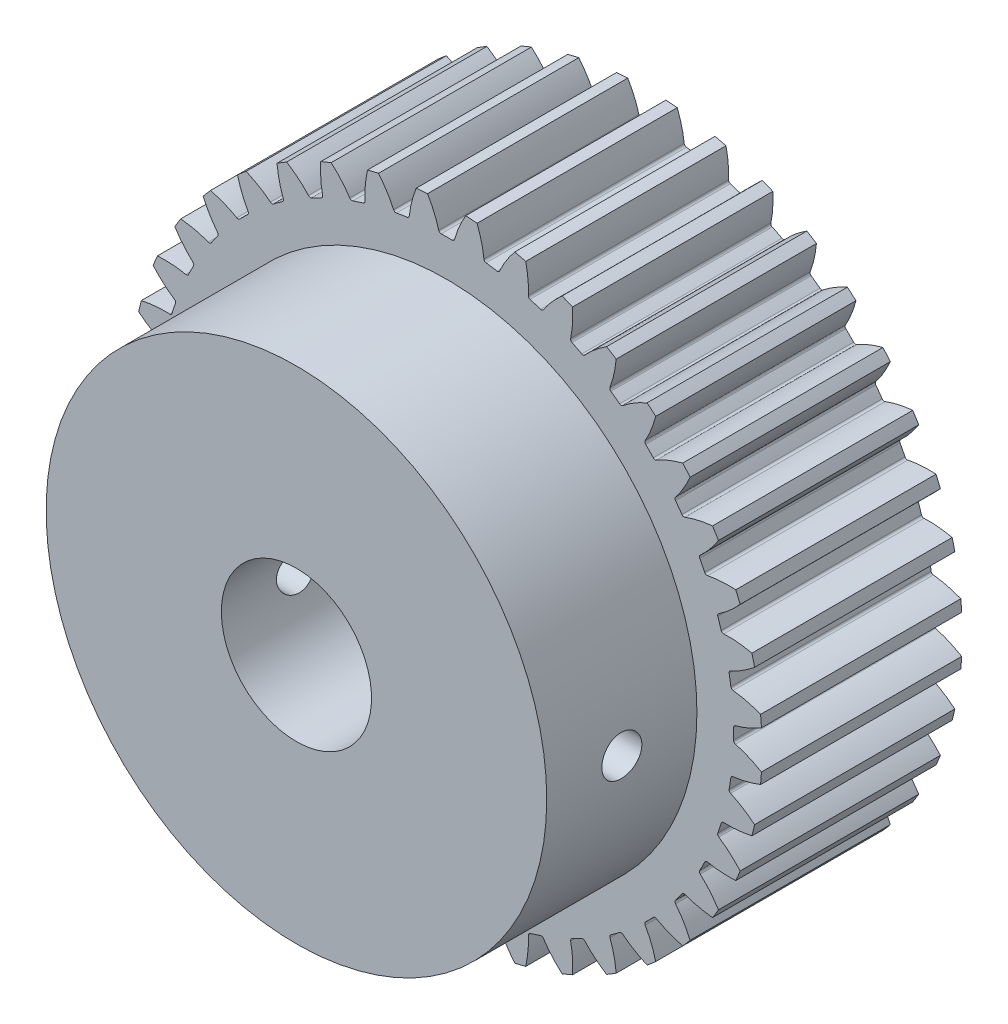
from build123d import *

# Parameters (mm, degrees)
SKETCH1_R                = 31.5
BOSS_EXTRUDE1_DEPTH      = 20
CUT_EXTRUDE2_DEPTH       = 49.831342394
FILLET1_R                = 0.25
CIRPATTERN1_COUNT        = 40
FILLET1_OF_CIRPATTERN1_R = 0.25
SKETCH1_8_R              = 25
BOSS_EXTRUDE2_DEPTH      = 35
SKETCH2_R                = 7.5
CUT_EXTRUDE4_DEPTH       = 57.588251431
SKETCH3_R                = 2
CUT_EXTRUDE6_DEPTH       = 74.480219868


with BuildPart() as part:
    # Sketch1 → Boss-Extrude1 (new body)
    with BuildSketch(Plane.XY):
        Circle(SKETCH1_R)
    extrude(amount=BOSS_EXTRUDE1_DEPTH)

    # Sketch1<5> → Cut-Extrude2 (cut, through all)
    with BuildSketch(Plane.XY):
        with BuildLine():
            add(Edge.make_bspline(
                [(-1.906543024, 31.442250137), (-1.695696445, 31.078842528), (-1.308431171, 30.336664954), (-0.941741922, 29.392730706), (-0.785074835, 28.820981083), (-0.748482141, 28.649753144)],
                knots=[0.31361624, 0.31361624, 0.31361624, 0.31361624, 0.385710722, 0.457140092, 0.487211711, 0.487211711, 0.487211711, 0.487211711], degree=3))
            ThreePointArc((-0.748482141, 28.649753144), (0, 28.65952862), (0.748482141, 28.649753144))
            add(Edge.make_bspline(
                [(1.906543024, 31.442250137), (1.695696445, 31.078842528), (1.308431171, 30.336664954), (0.941741922, 29.392730706), (0.785074835, 28.820981083), (0.748482141, 28.649753144)],
                knots=[0.31361624, 0.31361624, 0.31361624, 0.31361624, 0.385710722, 0.457140092, 0.487211711, 0.487211711, 0.487211711, 0.487211711], degree=3))
            ThreePointArc((1.906543024, 31.442250137), (0, 31.5), (-1.906543024, 31.442250137))
        make_face()
    cut_extrude2 = extrude(amount=CUT_EXTRUDE2_DEPTH, mode=Mode.SUBTRACT)

    # Fillet1
    fillet1_edges = [part.edges().sort_by_distance(p)[0] for p in [
        (0.748482141, 28.649753144, 10),
        (-0.748482141, 28.649753144, 10),
    ]]
    fillet(fillet1_edges, radius=FILLET1_R)

    # CirPattern1: Cut-Extrude2 ×40 about axis
    cirpattern1_axis = Axis((0, 0, 20), (0, 0, -1))
    for i in range(1, CIRPATTERN1_COUNT):
        add(cut_extrude2.rotate(cirpattern1_axis, i * 360 / CIRPATTERN1_COUNT), mode=Mode.SUBTRACT)

    # Fillet1 of CirPattern1
    fillet1_of_cirpattern1_edges = [part.edges().sort_by_distance(p)[0] for p in [
        (5.22107589, 28.179938738, 10),
        (3.742541723, 28.414115544, 10),
        (9.565109423, 27.016240716, 10),
        (8.141411789, 27.478828119, 10),
        (13.673618218, 25.187313187, 10),
        (12.339813277, 25.866920749, 10),
        (17.445437151, 22.738190414, 10),
        (16.234367608, 23.618083942, 10),
        (20.787691525, 19.72917793, 10),
        (19.72917793, 20.787691525, 10),
        (23.618083942, 16.234367608, 10),
        (22.738190414, 17.445437151, 10),
        (25.866920749, 12.339813277, 10),
        (25.187313187, 13.673618218, 10),
        (27.478828119, 8.141411789, 10),
        (27.016240716, 9.565109423, 10),
        (28.414115544, 3.742541723, 10),
        (28.179938738, 5.22107589, 10),
        (28.649753144, -0.748482141, 10),
        (28.649753144, 0.748482141, 10),
        (28.179938738, -5.22107589, 10),
        (28.414115544, -3.742541723, 10),
        (27.016240716, -9.565109423, 10),
        (27.478828119, -8.141411789, 10),
        (25.187313187, -13.673618218, 10),
        (25.866920749, -12.339813277, 10),
        (22.738190414, -17.445437151, 10),
        (23.618083942, -16.234367608, 10),
        (19.72917793, -20.787691525, 10),
        (20.787691525, -19.72917793, 10),
        (16.234367608, -23.618083942, 10),
        (17.445437151, -22.738190414, 10),
        (12.339813277, -25.866920749, 10),
        (13.673618218, -25.187313187, 10),
        (8.141411789, -27.478828119, 10),
        (9.565109423, -27.016240716, 10),
        (3.742541723, -28.414115544, 10),
        (5.22107589, -28.179938738, 10),
        (-0.748482141, -28.649753144, 10),
        (0.748482141, -28.649753144, 10),
        (-5.22107589, -28.179938738, 10),
        (-3.742541723, -28.414115544, 10),
        (-9.565109423, -27.016240716, 10),
        (-8.141411789, -27.478828119, 10),
        (-13.673618218, -25.187313187, 10),
        (-12.339813277, -25.866920749, 10),
        (-17.445437151, -22.738190414, 10),
        (-16.234367608, -23.618083942, 10),
        (-20.787691525, -19.72917793, 10),
        (-19.72917793, -20.787691525, 10),
        (-23.618083942, -16.234367608, 10),
        (-22.738190414, -17.445437151, 10),
        (-25.866920749, -12.339813277, 10),
        (-25.187313187, -13.673618218, 10),
        (-27.478828119, -8.141411789, 10),
        (-27.016240716, -9.565109423, 10),
        (-28.414115544, -3.742541723, 10),
        (-28.179938738, -5.22107589, 10),
        (-28.649753144, 0.748482141, 10),
        (-28.649753144, -0.748482141, 10),
        (-28.179938738, 5.22107589, 10),
        (-28.414115544, 3.742541723, 10),
        (-27.016240716, 9.565109423, 10),
        (-27.478828119, 8.141411789, 10),
        (-25.187313187, 13.673618218, 10),
        (-25.866920749, 12.339813277, 10),
        (-22.738190414, 17.445437151, 10),
        (-23.618083942, 16.234367608, 10),
        (-19.72917793, 20.787691525, 10),
        (-20.787691525, 19.72917793, 10),
        (-16.234367608, 23.618083942, 10),
        (-17.445437151, 22.738190414, 10),
        (-12.339813277, 25.866920749, 10),
        (-13.673618218, 25.187313187, 10),
        (-8.141411789, 27.478828119, 10),
        (-9.565109423, 27.016240716, 10),
        (-3.742541723, 28.414115544, 10),
        (-5.22107589, 28.179938738, 10),
    ]]
    fillet(fillet1_of_cirpattern1_edges, radius=FILLET1_OF_CIRPATTERN1_R)

    # Sketch1<8> → Boss-Extrude2 (add)
    with BuildSketch(Plane.XY):
        Circle(SKETCH1_8_R)
    extrude(amount=BOSS_EXTRUDE2_DEPTH)

    # Sketch2 → Cut-Extrude4 (cut, through all)
    with BuildSketch(Plane(origin=(0, 0, 0), x_dir=(-1, 0, 0), z_dir=(0, 0, -1))):
        Circle(SKETCH2_R)
    extrude(amount=-CUT_EXTRUDE4_DEPTH, mode=Mode.SUBTRACT)

    # Sketch3 → Cut-Extrude6 (cut, through all)
    with BuildSketch(Plane(origin=(25, 0, 0), x_dir=(0, 0, -1), z_dir=(1, 0, 0))):
        with Locations((-27.5, 0)):
            Circle(SKETCH3_R)
    extrude(amount=-CUT_EXTRUDE6_DEPTH, mode=Mode.SUBTRACT)


solid = part.part
